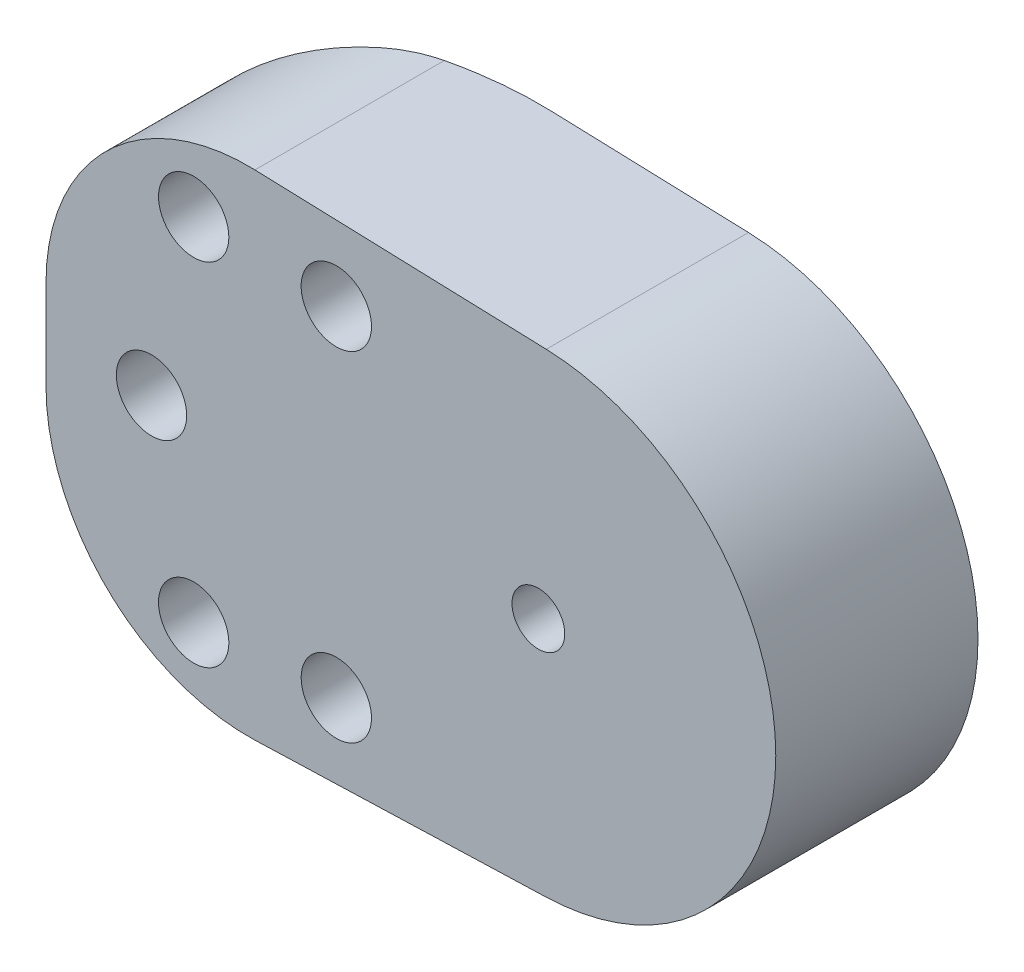
from build123d import *

# Parameters (mm, degrees)
CROQUIS1_R                 = 13.5
SALIENTE_EXTRUIR1_DEPTH    = 11.5
CROQUIS3_R                 = 2
CORTAR_EXTRUIR1_DEPTH      = 34.535832747
CORTAR_EXTRUIR2_DEPTH      = 34.535832747
CORTAR_EXTRUIR2_DEPTH_BACK = 34.535832747
REDONDEO1_R                = 20
REDONDEO2_R                = 11.5
CROQUIS5_R                 = 6
CORTAR_EXTRUIR3_DEPTH      = 7
CROQUIS6_R                 = 9.5
CORTAR_EXTRUIR4_DEPTH      = 5
CROQUIS7_R                 = 1.5
CORTAR_EXTRUIR5_DEPTH      = 33.099173306


with BuildPart() as part:
    # Croquis1 → Saliente-Extruir1 (new body)
    with BuildSketch(Plane.XY):
        with BuildLine():
            Line((0.447526726, 13.492580177), (-28, 14.436137919))
            Line((-28, 14.436137919), (-28, -14.436137919))
            Line((-28, -14.436137919), (0.447526726, -13.492580177))
            ThreePointArc((0.447526726, -13.492580177), (-13.5, 0), (0.447526726, 13.492580177))
        make_face()
        Circle(CROQUIS1_R)
    extrude(amount=SALIENTE_EXTRUIR1_DEPTH)

    # Croquis3 → Cortar-Extruir1 (cut, through all)
    with BuildSketch(Plane.XY.offset(11.5)):
        with Locations((-22, 0)):
            Circle(CROQUIS3_R)
        with Locations((-19.602143532, 9.987790994)):
            Circle(CROQUIS3_R)
        with Locations((-11.490666647, 9.641814145)):
            Circle(CROQUIS3_R)
        with Locations(Location((-19.602143532, -9.987790994, 0), (0, 0, 180))):
            Circle(CROQUIS3_R)
        with Locations(Location((-11.490666647, -9.641814145, 0), (0, 0, 180))):
            Circle(CROQUIS3_R)
    extrude(amount=-CORTAR_EXTRUIR1_DEPTH, mode=Mode.SUBTRACT)

    # Croquis4 → Cortar-Extruir2 (cut, two sides: drawn at the far end of the back side and taken through both)
    with BuildSketch(Plane(origin=(0, 0, 0), x_dir=(1, 0, 0), z_dir=(0, 1, 0)).offset(-CORTAR_EXTRUIR2_DEPTH_BACK)):
        Polygon((-15, 0), (-28, -5.75), (-28, 0), align=None)
    extrude(amount=CORTAR_EXTRUIR2_DEPTH + CORTAR_EXTRUIR2_DEPTH_BACK, mode=Mode.SUBTRACT)

    # Redondeo1
    # the kernel refuses this fillet: 20 mm, written as the material it takes off along each edge
    with BuildSketch(Plane(origin=(-15, -24.56902732, 0), x_dir=(1, 0, 0), z_dir=(0, 1, 0))) as redondeo1_piece_1:
        with BuildLine():
            CenterArc((REDONDEO1_R * 0.211281561014, -REDONDEO1_R), REDONDEO1_R, 90, 23.860175191)
            Line((-REDONDEO1_R * 0.193224453764, -REDONDEO1_R * 0.0854646622417), (0, 0))
            Line((0, 0), (REDONDEO1_R * 0.211281561014, 0))
        make_face()
    extrude(amount=49.138054639, mode=Mode.SUBTRACT)

    # Redondeo2
    # the kernel refuses this fillet: 11.5 mm, written as the material it takes off along each edge
    with BuildSketch(Plane(origin=(-28, 14.436137919, -23.969400449), x_dir=(0.9994503834734472, -0.033150127824481866, 0), z_dir=(0, 0, 1))) as redondeo2_piece_1:
        with BuildLine():
            CenterArc((REDONDEO2_R * 1.03371827647, -REDONDEO2_R), REDONDEO2_R, 90, 91.899710465)
            Line((REDONDEO2_R * 0.0342678929996, -REDONDEO2_R * 1.03315012782), (0, 0))
            Line((0, 0), (REDONDEO2_R * 1.03371827647, 0))
        make_face()
    extrude(amount=65.188800897, mode=Mode.SUBTRACT)
    with BuildSketch(Plane(origin=(-28, -14.436137919, -23.969400449), x_dir=(0.999450383473447, 0.033150127824482116, 0), z_dir=(0, 0, 1))) as redondeo2_piece_2:
        with BuildLine():
            CenterArc((REDONDEO2_R * 1.03371827647, REDONDEO2_R), REDONDEO2_R, 178.100289535, 91.899710465)
            Line((REDONDEO2_R * 0.0342678929996, REDONDEO2_R * 1.03315012782), (0, 0))
            Line((0, 0), (REDONDEO2_R * 1.03371827647, 0))
        make_face()
    extrude(amount=65.188800897, mode=Mode.SUBTRACT)

    # Croquis5 → Cortar-Extruir3 (cut)
    with BuildSketch(Plane(origin=(0, 0, 0), x_dir=(-1, 0, 0), z_dir=(0, 0, -1))):
        Circle(CROQUIS5_R)
    extrude(amount=-CORTAR_EXTRUIR3_DEPTH, mode=Mode.SUBTRACT)

    # Croquis6 → Cortar-Extruir4 (cut)
    with BuildSketch(Plane(origin=(0, 0, 0), x_dir=(-1, 0, 0), z_dir=(0, 0, -1))):
        Circle(CROQUIS6_R)
    extrude(amount=-CORTAR_EXTRUIR4_DEPTH, mode=Mode.SUBTRACT)

    # Croquis7 → Cortar-Extruir5 (cut, through all)
    with BuildSketch(Plane(origin=(0, 0, 7), x_dir=(-1, 0, 0), z_dir=(0, 0, -1))):
        Circle(CROQUIS7_R)
    extrude(amount=-CORTAR_EXTRUIR5_DEPTH, mode=Mode.SUBTRACT)


solid = part.part
